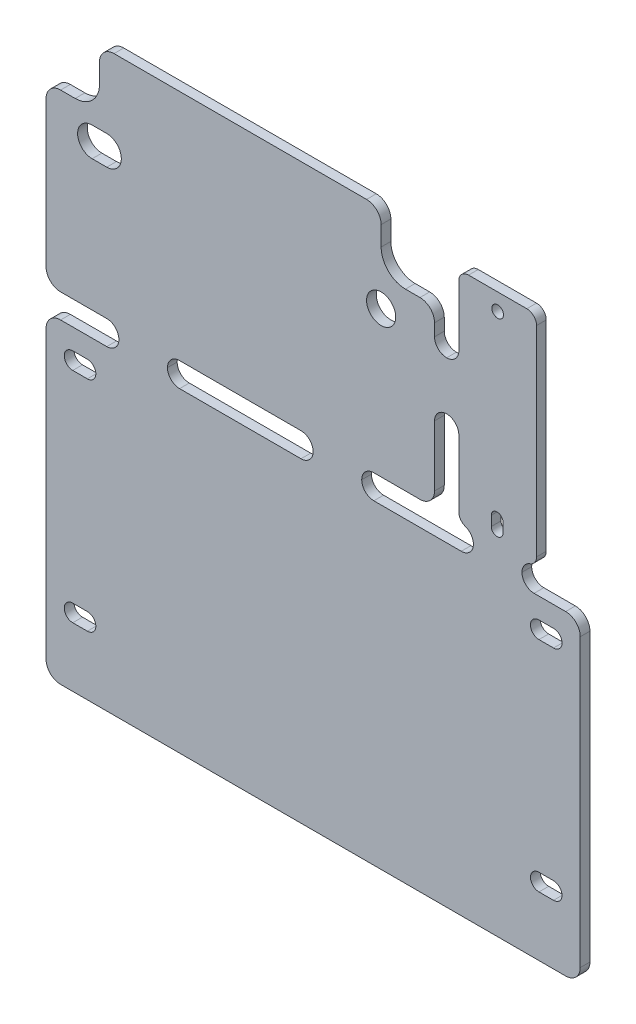
from build123d import *

# Parameters (mm, degrees)
SKETCH_1_W      = 110
SKETCH_1_H      = 65
EXTRUDE_1_DEPTH = 2
FILLET_1_R      = 3
SKETCH_2_R      = 3
EXTRUDE_2_DEPTH = 2
FILLET_5_R      = 3
FILLET_6_R      = 5
SKETCH_4_W      = 10
SKETCH_4_H      = 5
EXTRUDE_4_DEPTH = 2
FILLET_7_R      = 2.5
SKETCH_5_W      = 16
SKETCH_5_H      = 45
SKETCH_5_R      = 1.2
EXTRUDE_5_DEPTH = 2
SKETCH_6_W      = 10
SKETCH_6_H      = 5
SKETCH_6_W_2    = 5
SKETCH_6_H_2    = 10
EXTRUDE_6_DEPTH = 2
FILLET_8_R      = 2.5
FILLET_9_R      = 2


with BuildPart() as part:
    # ｽｹｯﾁ1 → ﾎﾞｽ - 押し出し1 (new body)
    with BuildSketch(Plane.XY):
        Rectangle(SKETCH_1_W, SKETCH_1_H)
        with BuildLine():
            Line((-49.5, 24.75), (-46.5, 24.75))
            ThreePointArc((-46.5, 24.75), (-44.75, 26.5), (-46.5, 28.25))
            Line((-46.5, 28.25), (-49.5, 28.25))
            ThreePointArc((-49.5, 28.25), (-51.25, 26.5), (-49.5, 24.75))
        make_face(mode=Mode.SUBTRACT)
        with BuildLine():
            Line((-46.5, -20.25), (-49.5, -20.25))
            ThreePointArc((-49.5, -20.25), (-51.25, -18.5), (-49.5, -16.75))
            Line((-49.5, -16.75), (-46.5, -16.75))
            ThreePointArc((-46.5, -16.75), (-44.75, -18.5), (-46.5, -20.25))
        make_face(mode=Mode.SUBTRACT)
        with BuildLine():
            Line((46.5, -20.25), (49.5, -20.25))
            ThreePointArc((49.5, -20.25), (51.25, -18.5), (49.5, -16.75))
            Line((49.5, -16.75), (46.5, -16.75))
            ThreePointArc((46.5, -16.75), (44.75, -18.5), (46.5, -20.25))
        make_face(mode=Mode.SUBTRACT)
        with BuildLine():
            Line((46.5, 28.25), (49.5, 28.25))
            ThreePointArc((49.5, 28.25), (51.25, 26.5), (49.5, 24.75))
            Line((49.5, 24.75), (46.5, 24.75))
            ThreePointArc((46.5, 24.75), (44.75, 26.5), (46.5, 28.25))
        make_face(mode=Mode.SUBTRACT)
    extrude(amount=EXTRUDE_1_DEPTH)

    # ﾌｨﾚｯﾄ1
    fillet_1_edges = [part.edges().sort_by_distance(p)[0] for p in [
        (-55, 32.5, 1),
        (55, 32.5, 1),
        (55, -32.5, 1),
        (-55, -32.5, 1),
    ]]
    fillet(fillet_1_edges, radius=FILLET_1_R)



with BuildPart() as body_2:
    # ｽｹｯﾁ2 → ﾎﾞｽ - 押し出し2 (new body)
    with BuildSketch(Plane.XY.offset(2)):
        Polygon((-55, 37.5), (25, 37.5), (25, 73.5), (14, 73.5), (14, 85.5), (-44, 85.5), (-44, 73.5), (-55, 73.5), align=None)
        with Locations((14, 67.5)):
            Circle(SKETCH_2_R, mode=Mode.SUBTRACT)
        with BuildLine():
            Line((-45.5, 64.5), (-42.5, 64.5))
            ThreePointArc((-42.5, 64.5), (-39.5, 67.5), (-42.5, 70.5))
            Line((-42.5, 70.5), (-45.5, 70.5))
            ThreePointArc((-45.5, 70.5), (-48.5, 67.5), (-45.5, 64.5))
        make_face(mode=Mode.SUBTRACT)
    extrude(amount=-EXTRUDE_2_DEPTH)

    # ﾌｨﾚｯﾄ5
    fillet_5_edges = [body_2.edges().sort_by_distance(p)[0] for p in [
        (25, 37.5, 1),
        (-55, 37.5, 1),
        (-55, 73.5, 1),
        (-44, 85.5, 1),
        (14, 85.5, 1),
        (25, 73.5, 1),
    ]]
    fillet(fillet_5_edges, radius=FILLET_5_R)

    # ﾌｨﾚｯﾄ6
    fillet_6_edges = [body_2.edges().sort_by_distance(p)[0] for p in [
        (-44, 73.5, 1),
        (14, 73.5, 1),
    ]]
    fillet(fillet_6_edges, radius=FILLET_6_R)


with BuildPart() as part_1:
    add(part.part)

    add(body_2.part)  # ﾎﾞｽ - 押し出し4 merges body 2
    # ｽｹｯﾁ4 → ﾎﾞｽ - 押し出し4 (add)
    with BuildSketch(Plane.XY.offset(2)):
        with Locations((-35, 35)):
            Rectangle(SKETCH_4_W, SKETCH_4_H)
        with Locations((5, 35)):
            Rectangle(SKETCH_4_W, SKETCH_4_H)
    extrude(amount=-EXTRUDE_4_DEPTH)

    # ﾌｨﾚｯﾄ7
    fillet_7_edges = [part_1.edges().sort_by_distance(p)[0] for p in [
        (10, 37.5, 1),
        (10, 32.5, 1),
        (0, 37.5, 1),
        (0, 32.5, 1),
        (-30, 37.5, 1),
        (-30, 32.5, 1),
        (-40, 37.5, 1),
        (-40, 32.5, 1),
    ]]
    fillet(fillet_7_edges, radius=FILLET_7_R - 0.0001)  # a hair under: the kernel refuses the full size



with BuildPart() as body_2_2:
    # ｽｹｯﾁ5 → ﾎﾞｽ - 押し出し5 (new body)
    with BuildSketch(Plane.XY.offset(2)):
        with Locations((38, 60)):
            Rectangle(SKETCH_5_W, SKETCH_5_H)
        with Locations((38, 79)):
            Circle(SKETCH_5_R, mode=Mode.SUBTRACT)
        with BuildLine():
            Line((36.683223365, 42), (36.683223365, 40))
            ThreePointArc((36.683223365, 40), (37.883223365, 38.8), (39.083223365, 40))
            Line((39.083223365, 40), (39.083223365, 42))
            ThreePointArc((39.083223365, 42), (37.883223365, 43.2), (36.683223365, 42))
        make_face(mode=Mode.SUBTRACT)
    extrude(amount=-EXTRUDE_5_DEPTH)


with BuildPart() as part_2:
    add(part_1.part)

    add(body_2_2.part)  # ﾎﾞｽ - 押し出し6 merges body 2 2
    # ｽｹｯﾁ6 → ﾎﾞｽ - 押し出し6 (add)
    with BuildSketch(Plane.XY.offset(2)):
        with Locations((38, 35)):
            Rectangle(SKETCH_6_W, SKETCH_6_H)
        with Locations((27.5, 60.5)):
            Rectangle(SKETCH_6_W_2, SKETCH_6_H_2)
    extrude(amount=-EXTRUDE_6_DEPTH)

    # ﾌｨﾚｯﾄ8
    fillet_8_edges = [part_2.edges().sort_by_distance(p)[0] for p in [
        (43, 32.5, 1),
        (43, 37.5, 1),
        (33, 32.5, 1),
        (33, 37.5, 1),
        (30, 55.5, 1),
        (25, 55.5, 1),
        (25, 65.5, 1),
        (30, 65.5, 1),
    ]]
    fillet(fillet_8_edges, radius=FILLET_8_R - 0.0001)  # a hair under: the kernel refuses the full size

    # ﾌｨﾚｯﾄ9
    fillet_9_edges = [part_2.edges().sort_by_distance(p)[0] for p in [
        (46, 82.5, 1),
        (30, 82.5, 1),
        (46, 37.5, 1),
        (30, 37.5, 1),
    ]]
    fillet(fillet_9_edges, radius=FILLET_9_R)


solid = part_2.part
